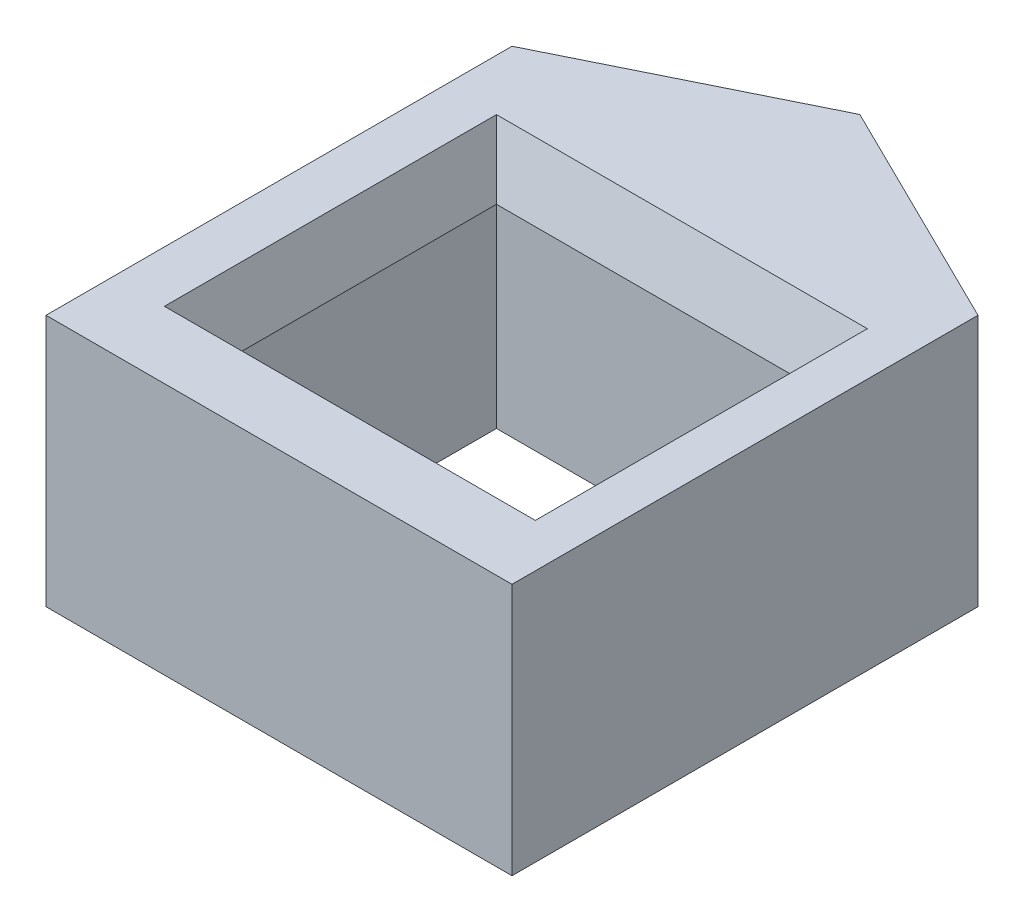
from build123d import *

# Parameters (mm, degrees)
SKETCH1_W           = 8.55
SKETCH1_H           = 7.55
BOSS_EXTRUDE1_DEPTH = 6.5
CHAMFER1_SIZE       = 0.5
CHAMFER1_SIZE2      = 1.5


with BuildPart() as part:
    # Sketch1 → Boss-Extrude1 (new body)
    with BuildSketch(Plane(origin=(0, 0, 0), x_dir=(1, 0, 0), z_dir=(0, 1, 0))):
        Polygon((-6, 6), (0, 8.956366238), (6, 6), (6, -6), (-6, -6), align=None)
        with Locations((0.1, 0)):
            Rectangle(SKETCH1_W, SKETCH1_H, mode=Mode.SUBTRACT)
    extrude(amount=BOSS_EXTRUDE1_DEPTH)

    # Chamfer1
    chamfer1_edges = [part.edges().sort_by_distance(p)[0] for p in [
        (4.375, 6.5, 0),
        (0.1, 6.5, 3.775),
        (-4.175, 6.5, 0),
        (0.1, 6.5, -3.775),
    ]]
    chamfer1_side = [part.faces().sort_by_distance(p)[0] for p in [
        (-2.915247529, 6.5, -7.30617641),
    ]]
    chamfer(chamfer1_edges, length=CHAMFER1_SIZE, length2=CHAMFER1_SIZE2, reference=chamfer1_side[0])


solid = part.part
